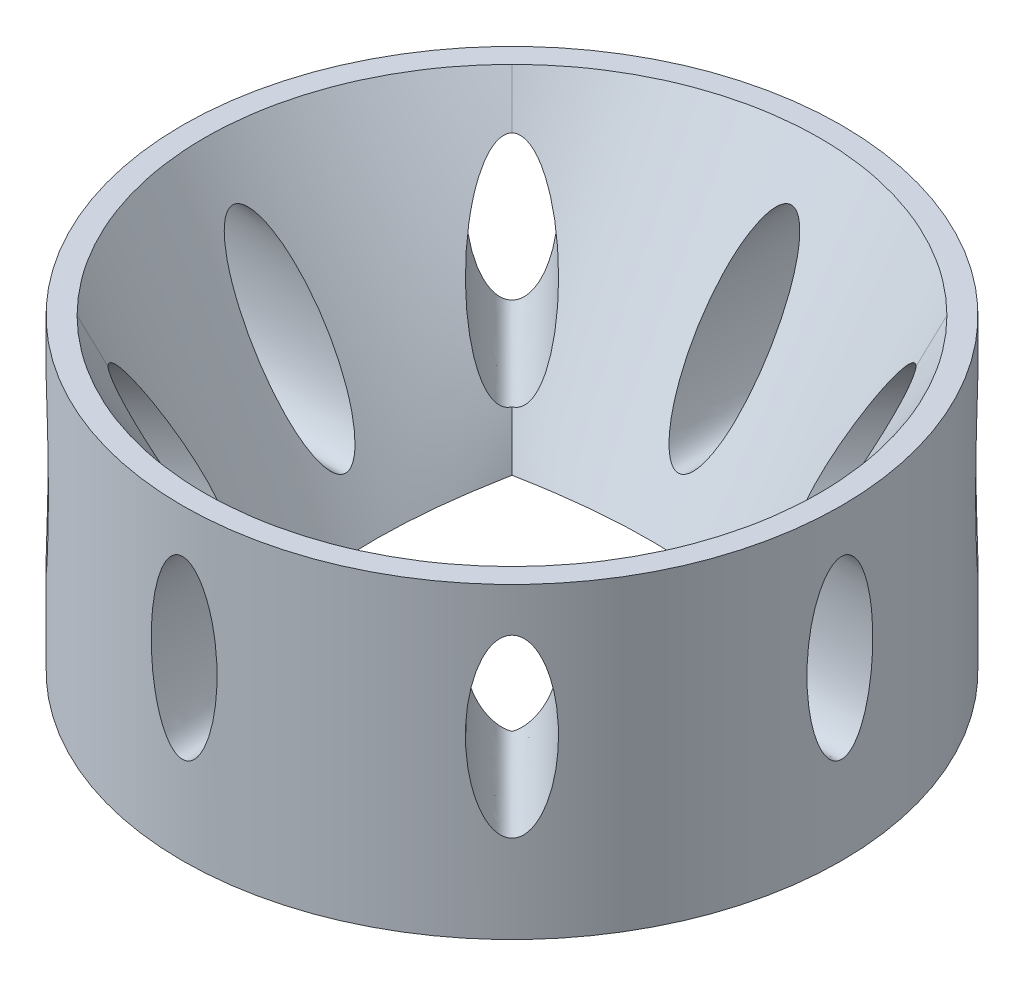
from build123d import *

# Parameters (mm, degrees)
SKETCH_5_R               = 7.5
EXTRUDE_1_DEPTH          = 7
SKETCH_13_RX             = 2
SKETCH_13_RY             = 0.75
CUT_EXTRUDE_5_DEPTH      = 13.7082652
PATTERN_CIRCULAR_1_COUNT = 8
SKETCH_14_R              = 6
CUT_EXTRUDE_6_DEPTH      = 1


with BuildPart() as part:
    # Эскиз5 → Бобышка-Вытянуть1 (new body)
    with BuildSketch(Plane(origin=(0, 0, 0), x_dir=(1, 0, 0), z_dir=(0, 1, 0))):
        Circle(SKETCH_5_R)
    extrude(amount=EXTRUDE_1_DEPTH)

    # Эскиз7 for Вырез-По сечениям4 → Вырез-По сечениям4 section 0
    with BuildSketch(Plane(origin=(0, 7, 0), x_dir=(1, 0, 0), z_dir=(0, 1, 0))):
        with BuildLine():
            # circular arc as an exact rational Bezier (weights 1, cos(half-angle), 1)
            Bezier((-4.949747468, 4.949747468), (0, 9.899494937), (4.949747468, 4.949747468), weights=[1, 0.707106781, 1])
            Bezier((4.949747468, 4.949747468), (9.899494937, 0), (4.949747468, -4.949747468), weights=[1, 0.707106781, 1])
            Bezier((4.949747468, -4.949747468), (0, -9.899494937), (-4.949747468, -4.949747468), weights=[1, 0.707106781, 1])
            Bezier((-4.949747468, -4.949747468), (-9.899494937, 0), (-4.949747468, 4.949747468), weights=[1, 0.707106781, 1])
        make_face()
    # Эскиз8 → Вырез-По сечениям4 section 1
    with BuildSketch(Plane.XZ):
        with BuildLine():
            Line((-2.5, -2.5), (2.5, -2.5))
            Line((2.5, -2.5), (2.5, 2.5))
            Line((2.5, 2.5), (-2.5, 2.5))
            Line((-2.5, 2.5), (-2.5, -2.5))
        make_face()
    loft(mode=Mode.SUBTRACT)

    # Эскиз13 → Вырез-Вытянуть5 (cut, through all)
    with BuildSketch(Plane(origin=(0, 0, 0), x_dir=(0, 0, -1), z_dir=(1, 0, 0))):
        with Locations(Location((0, 4), (0, 0, -90))):
            Ellipse(SKETCH_13_RX, SKETCH_13_RY)
    cut_extrude_5 = extrude(amount=-CUT_EXTRUDE_5_DEPTH, mode=Mode.SUBTRACT)

    # Круговой массив1: Вырез-Вытянуть5 ×8 about axis
    pattern_circular_1_axis = Axis((0, 7.35133243, 0), (0, -1, 0))
    for i in range(1, PATTERN_CIRCULAR_1_COUNT):
        add(cut_extrude_5.rotate(pattern_circular_1_axis, i * 360 / PATTERN_CIRCULAR_1_COUNT), mode=Mode.SUBTRACT)

    # Эскиз14 → Вырез-Вытянуть6 (cut)
    with BuildSketch(Plane.XZ):
        Circle(SKETCH_14_R)
    extrude(amount=-CUT_EXTRUDE_6_DEPTH, mode=Mode.SUBTRACT)


solid = part.part
